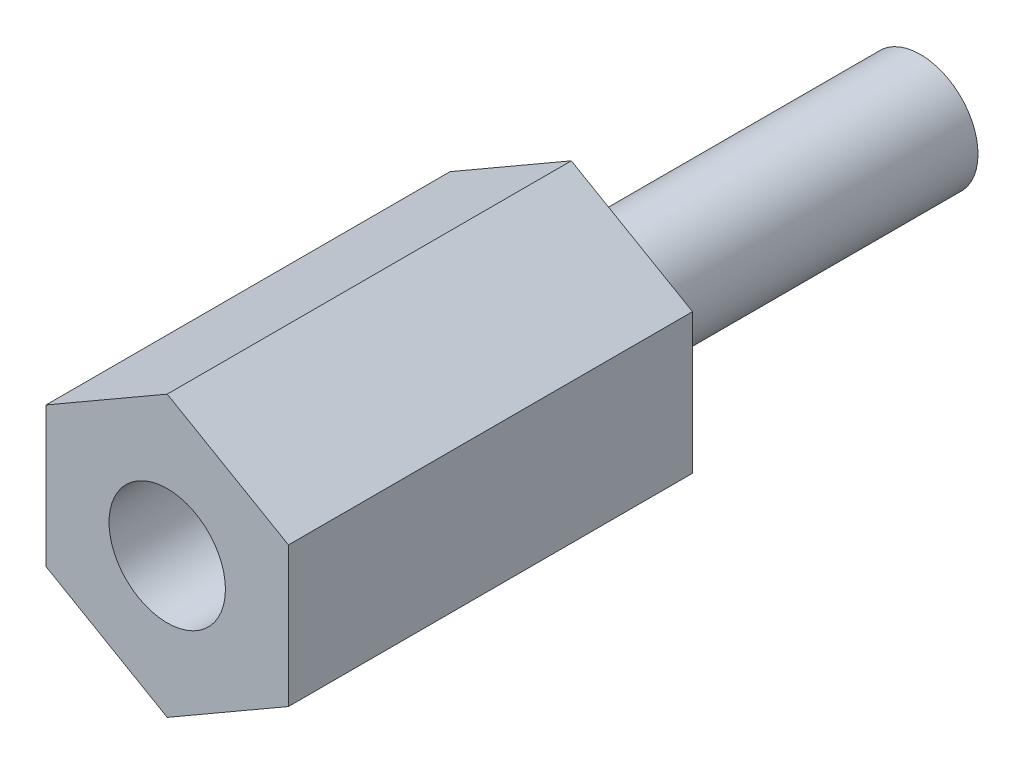
from build123d import *

# Parameters (mm, degrees)
BOSS_EXTRUDE1_DEPTH = 7.9375
SKETCH2_R           = 1.1303
BOSS_EXTRUDE2_DEPTH = 6.858
SKETCH3_R           = 1.143
CUT_EXTRUDE1_DEPTH  = 2.54


with BuildPart() as part:
    # Sketch1 → Boss-Extrude1 (new body)
    with BuildSketch(Plane.XY):
        Polygon((0, 2.749630657), (-2.38125, 1.374815329), (-2.38125, -1.374815329), (0, -2.749630657), (2.38125, -1.374815329), (2.38125, 1.374815329), align=None)
    extrude(amount=BOSS_EXTRUDE1_DEPTH)

    # Sketch2 → Boss-Extrude2 (add)
    with BuildSketch(Plane(origin=(0, 0, 0), x_dir=(-1, 0, 0), z_dir=(0, 0, -1))):
        Circle(SKETCH2_R)
    extrude(amount=BOSS_EXTRUDE2_DEPTH)

    # Sketch3 → Cut-Extrude1 (cut)
    with BuildSketch(Plane.XY.offset(7.9375)):
        Circle(SKETCH3_R)
    extrude(amount=-CUT_EXTRUDE1_DEPTH, mode=Mode.SUBTRACT)


solid = part.part
